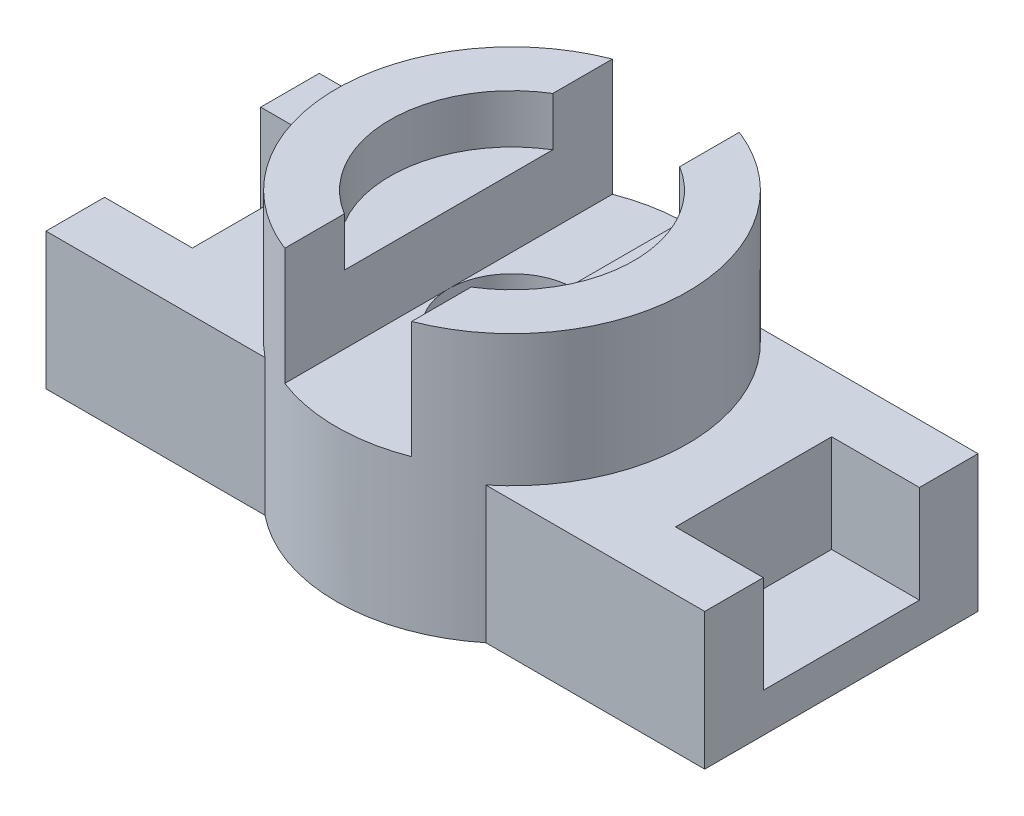
from build123d import *

# Parameters (mm, degrees)
BOSS_EXTRUDE1_DEPTH   = 28
BOSS_EXTRUDE1_2_DEPTH = 28
SKETCH1_4_R           = 36
BOSS_EXTRUDE2_DEPTH   = 55
SKETCH1_5_R           = 13
CUT_EXTRUDE1_DEPTH    = 95.21915941
CUT_EXTRUDE2_START    = -10
SKETCH2_R             = 25
SKETCH2_R_2           = 13
CUT_EXTRUDE2_DEPTH    = 10
SKETCH2_3_W           = 26
SKETCH2_3_H           = 91.506160118
CUT_EXTRUDE3_DEPTH    = 24
SKETCH3_W             = 36
SKETCH3_H             = 32
CUT_EXTRUDE4_DEPTH    = 20


with BuildPart() as part:
    # Sketch1 → Boss-Extrude1 (new body)
    with BuildSketch(Plane(origin=(0, 0, 0), x_dir=(1, 0, 0), z_dir=(0, 1, 0))):
        with BuildLine():
            Line((-67.5, 28), (-67.5, -28))
            Line((-67.5, -28), (-22.627416998, -28))
            ThreePointArc((-22.627416998, -28), (-36, 0), (-22.627416998, 28))
            Line((-22.627416998, 28), (-67.5, 28))
        make_face()
    extrude(amount=BOSS_EXTRUDE1_DEPTH)



with BuildPart() as body_2:
    # Sketch1 → Boss-Extrude1 2 (new body)
    with BuildSketch(Plane(origin=(0, 0, 0), x_dir=(1, 0, 0), z_dir=(0, 1, 0))):
        with BuildLine():
            ThreePointArc((22.627416998, 28), (36, 0), (22.627416998, -28))
            Line((22.627416998, -28), (67.5, -28))
            Line((67.5, -28), (67.5, 28))
            Line((67.5, 28), (22.627416998, 28))
        make_face()
    extrude(amount=BOSS_EXTRUDE1_2_DEPTH)


with BuildPart() as part_1:
    add(part.part)

    add(body_2.part)  # Boss-Extrude2 merges body 2
    # Sketch1<4> → Boss-Extrude2 (add)
    with BuildSketch(Plane(origin=(0, 0, 0), x_dir=(1, 0, 0), z_dir=(0, 1, 0))):
        Circle(SKETCH1_4_R)
    extrude(amount=BOSS_EXTRUDE2_DEPTH)

    # Sketch1<5> → Cut-Extrude1 (cut, through all)
    with BuildSketch(Plane(origin=(0, 0, 0), x_dir=(1, 0, 0), z_dir=(0, 1, 0))):
        Circle(SKETCH1_5_R)
    extrude(amount=CUT_EXTRUDE1_DEPTH, mode=Mode.SUBTRACT)

    # Sketch2 → Cut-Extrude2 (cut)
    with BuildSketch(Plane(origin=(0, 55, 0), x_dir=(1, 0, 0), z_dir=(0, 1, 0)).offset(CUT_EXTRUDE2_START)):
        Circle(SKETCH2_R)
        Circle(SKETCH2_R_2, mode=Mode.SUBTRACT)
    extrude(amount=CUT_EXTRUDE2_DEPTH, mode=Mode.SUBTRACT)

    # Sketch2<3> → Cut-Extrude3 (cut)
    with BuildSketch(Plane(origin=(0, 55, 0), x_dir=(1, 0, 0), z_dir=(0, 1, 0))):
        Rectangle(SKETCH2_3_W, SKETCH2_3_H)
    extrude(amount=-CUT_EXTRUDE3_DEPTH, mode=Mode.SUBTRACT)

    # Sketch3 → Cut-Extrude4 (cut)
    with BuildSketch(Plane(origin=(0, 28, 0), x_dir=(1, 0, 0), z_dir=(0, 1, 0))):
        with Locations((67.5, 0)):
            Rectangle(SKETCH3_W, SKETCH3_H)
        with Locations((-67.5, 0)):
            Rectangle(SKETCH3_W, SKETCH3_H)
    extrude(amount=-CUT_EXTRUDE4_DEPTH, mode=Mode.SUBTRACT)


solid = part_1.part
